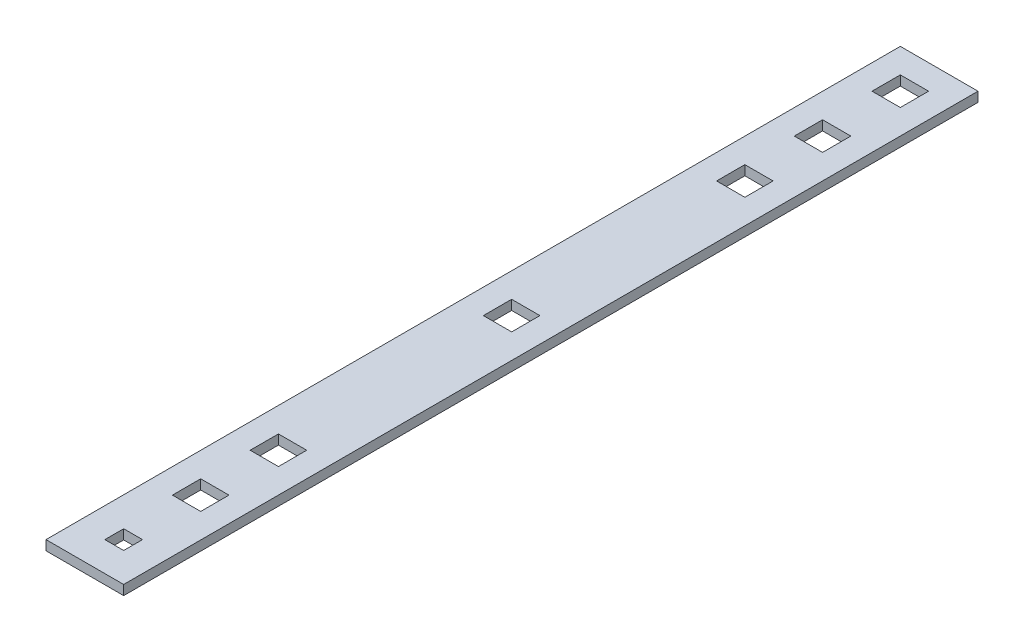
from build123d import *

# Parameters (mm, degrees)
SKETCH1_W           = 12.7
SKETCH1_H           = 139.7
SKETCH1_W_2         = 4.6228
SKETCH1_H_2         = 4.6228
SKETCH1_W_3         = 3.08
SKETCH1_H_3         = 3.08
BOSS_EXTRUDE1_DEPTH = 1.5875


with BuildPart() as part:
    # Sketch1 → Boss-Extrude1 (new body)
    with BuildSketch(Plane(origin=(0, 0, 0), x_dir=(1, 0, 0), z_dir=(0, 1, 0))):
        with Locations((6.312912156, 31.687542426)):
            Rectangle(SKETCH1_W, SKETCH1_H)
        with Locations((6.311512156, 95.186142426)):
            Rectangle(SKETCH1_W_2, SKETCH1_H_2, mode=Mode.SUBTRACT)
        with Locations((6.311512156, 82.474863648)):
            Rectangle(SKETCH1_W_2, SKETCH1_H_2, mode=Mode.SUBTRACT)
        with Locations((6.311512156, 69.763584871)):
            Rectangle(SKETCH1_W_2, SKETCH1_H_2, mode=Mode.SUBTRACT)
        with Locations((6.312912156, -31.812457574)):
            Rectangle(SKETCH1_W_3, SKETCH1_H_3, mode=Mode.SUBTRACT)
        with Locations((6.311512156, 31.629748538)):
            Rectangle(SKETCH1_W_2, SKETCH1_H_2, mode=Mode.SUBTRACT)
        with Locations((6.311512156, -6.504087794)):
            Rectangle(SKETCH1_W_2, SKETCH1_H_2, mode=Mode.SUBTRACT)
        with Locations((6.311512156, -19.215366572)):
            Rectangle(SKETCH1_W_2, SKETCH1_H_2, mode=Mode.SUBTRACT)
    extrude(amount=BOSS_EXTRUDE1_DEPTH)


solid = part.part
